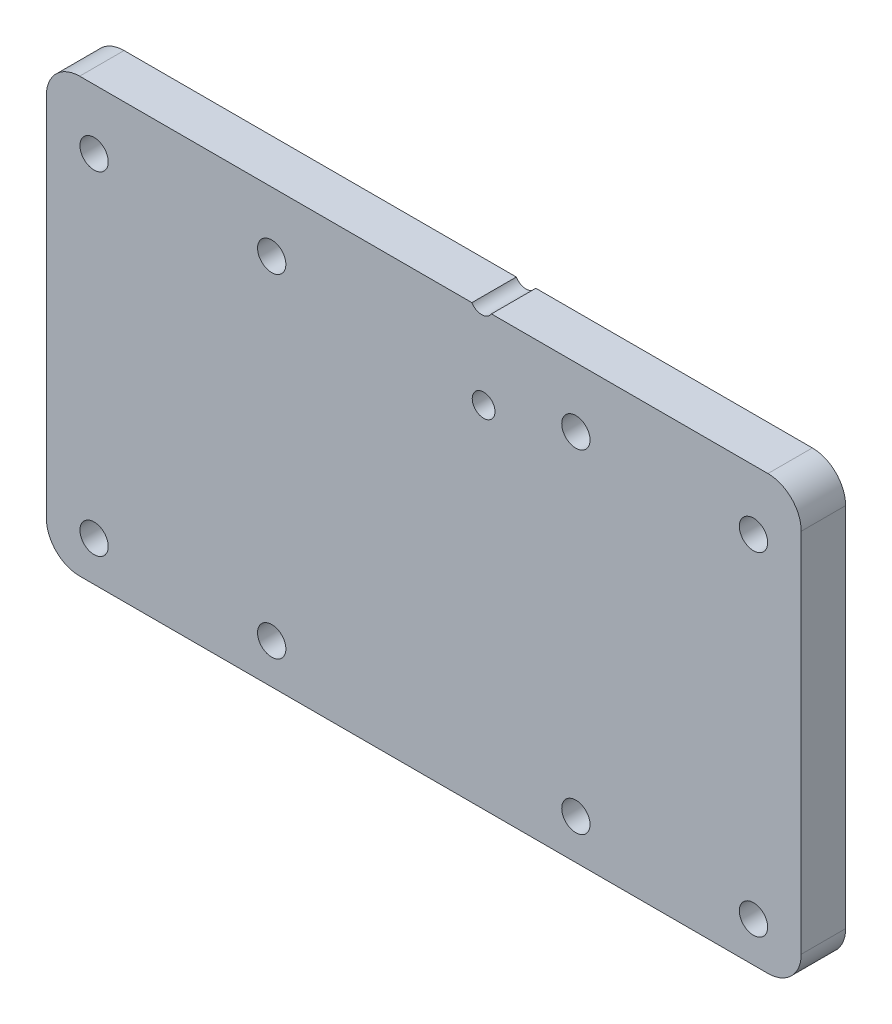
from build123d import *

# Parameters (mm, degrees)
SKETCH_1_W          = 68
SKETCH_1_H          = 39
EXTRUDE_1_DEPTH     = 4
SKETCH_2_R          = 1.275
CUT_EXTRUDE_1_DEPTH = 51.4
SKETCH_3_R          = 1.025
CUT_EXTRUDE_2_DEPTH = 81.4
FILLET_1_R          = 3


with BuildPart() as part:
    # 草图1 → 凸台-拉伸1 (new body)
    with BuildSketch(Plane.XY):
        Rectangle(SKETCH_1_W, SKETCH_1_H)
    extrude(amount=EXTRUDE_1_DEPTH)

    # 草图2 → 切除-拉伸1 (cut)
    with BuildSketch(Plane(origin=(0, 0, 0), x_dir=(-1, 0, 0), z_dir=(0, 0, -1))):
        with Locations((29.7, 14.1)):
            Circle(SKETCH_2_R)
        with Locations((13.7, 14.1)):
            Circle(SKETCH_2_R)
        with Locations((13.7, -15.9)):
            Circle(SKETCH_2_R)
        with Locations((29.7, -15.9)):
            Circle(SKETCH_2_R)
        with Locations((-13.7, -15.9)):
            Circle(SKETCH_2_R)
        with Locations((-13.7, 14.1)):
            Circle(SKETCH_2_R)
        with Locations((-29.7, 14.1)):
            Circle(SKETCH_2_R)
        with Locations((-29.7, -15.9)):
            Circle(SKETCH_2_R)
    extrude(amount=-CUT_EXTRUDE_1_DEPTH, mode=Mode.SUBTRACT)

    # 草图3 → 切除-拉伸2 (cut)
    with BuildSketch(Plane(origin=(0, 0, 0), x_dir=(-1, 0, 0), z_dir=(0, 0, -1))):
        with Locations((-5.211913244, 20.027268211)):
            Circle(SKETCH_3_R)
        with Locations((-5.387099809, 12.029186587)):
            Circle(SKETCH_3_R)
    extrude(amount=-CUT_EXTRUDE_2_DEPTH, mode=Mode.SUBTRACT)

    # 圆角1
    fillet_1_edges = [part.edges().sort_by_distance(p)[0] for p in [
        (34, -19.5, 2),
        (34, 19.5, 2),
        (-34, -19.5, 2),
        (-34, 19.5, 2),
    ]]
    fillet(fillet_1_edges, radius=FILLET_1_R)


solid = part.part
